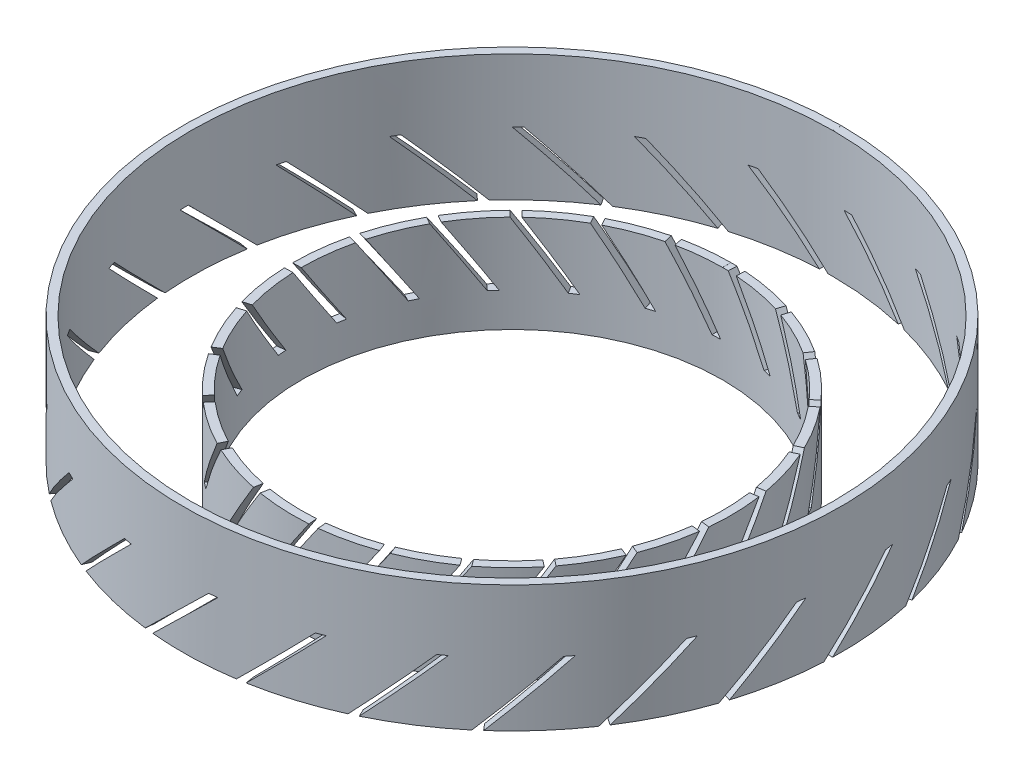
from build123d import *

# Parameters (mm, degrees)
BOSS_EXTRUDE1_DEPTH      = 13
BOSS_EXTRUDE2_DEPTH      = 6.5
BOSS_EXTRUDE2_DEPTH_BACK = 3.5


with BuildPart() as part:
    # Sketch2 → Boss-Extrude1 (new body)
    with BuildSketch(Plane(origin=(0, 0, 0), x_dir=(1, 0, 0), z_dir=(0, 1, 0))):
        with BuildLine():
            ThreePointArc((33, 0), (-23.334523779, -23.334523779), (0, 33))
            Line((0, 33), (0, 33.8636))
            ThreePointArc((0, 33.8636), (-23.945181195, -23.945181195), (33.8636, 0))
            ThreePointArc((33.8636, 0), (23.947270715, 23.943091493), (0.005910313, 33.863599484))
            Line((0.005910313, 33.863599484), (0.005759587, 32.999999497))
            ThreePointArc((0.005759587, 32.999999497), (23.336560012, 23.332487369), (33, 0))
        make_face()
    extrude(amount=BOSS_EXTRUDE1_DEPTH)


with BuildPart() as body_2:
    # Sketch3 → Boss-Extrude2 (new, two sides: drawn at the far end of the back side and taken through both)
    with BuildSketch(Plane(origin=(0, 0, 0), x_dir=(1, 0, 0), z_dir=(0, 1, 0)).offset(-BOSS_EXTRUDE2_DEPTH_BACK)):
        with BuildLine():
            ThreePointArc((21.6364, 0), (-15.29924516, -15.29924516), (0, 21.6364))
            Line((0, 21.6364), (0, 22.5))
            ThreePointArc((0, 22.5), (-15.909902577, -15.909902577), (22.5, 0))
            ThreePointArc((22.5, 0), (15.911290917, 15.908514115), (0.003926991, 22.499999657))
            Line((0.003926991, 22.499999657), (0.003776264, 21.63639967))
            ThreePointArc((0.003776264, 21.63639967), (15.300580213, 15.297909991), (21.6364, 0))
        make_face()
    extrude(amount=BOSS_EXTRUDE2_DEPTH + BOSS_EXTRUDE2_DEPTH_BACK)


with BuildPart() as cut_loft1_tool:
    # Sketch4 → Cut-Loft1 section 0
    with BuildSketch(Plane(origin=(0, 0, 0), x_dir=(1, 0, 0), z_dir=(0, 1, 0))):
        with BuildLine():
            Line((-13.794937288, 42.835571158), (-12.970410671, 43.092399542))
            Line((-12.970410671, 43.092399542), (-4.048628018, 14.449742642))
            Line((-4.048628018, 14.449742642), (-4.873154635, 14.192914258))
            Line((-4.873154635, 14.192914258), (-13.794937288, 42.835571158))
        make_face()
    # Sketch5 → Cut-Loft1 section 1
    with BuildSketch(Plane(origin=(0, 6.5, 0), x_dir=(1, 0, 0), z_dir=(0, 1, 0))):
        with BuildLine():
            Line((-7.559733693, 12.962903908), (-6.801515338, 13.376316397))
            Line((-6.801515338, 13.376316397), (-21.162764368, 39.715536702))
            Line((-21.162764368, 39.715536702), (-21.920982723, 39.302124213))
            Line((-21.920982723, 39.302124213), (-7.559733693, 12.962903908))
        make_face()
    loft()


with BuildPart() as part_1:
    add(part.part)

    # Cut-Loft1: cut by cut_loft1_tool
    add(cut_loft1_tool.part, mode=Mode.SUBTRACT)


with BuildPart() as body_2_1:
    add(body_2.part)

    # Cut-Loft1: cut by cut_loft1_tool
    add(cut_loft1_tool.part, mode=Mode.SUBTRACT)


with BuildPart() as cut_loft2_tool:
    # Sketch4<3> → Cut-Loft2 section 0
    with BuildSketch(Plane(origin=(0, 0, 0), x_dir=(1, 0, 0), z_dir=(0, 1, 0))):
        with BuildLine():
            Line((-24.840282382, 37.525282443), (-24.115622917, 37.995041552))
            Line((-24.115622917, 37.995041552), (-7.796987818, 12.82160022))
            Line((-7.796987818, 12.82160022), (-8.521647282, 12.351841111))
            Line((-8.521647282, 12.351841111), (-24.840282382, 37.525282443))
        make_face()
    # Sketch5<3> → Cut-Loft2 section 1
    with BuildSketch(Plane(origin=(0, 6.5, 0), x_dir=(1, 0, 0), z_dir=(0, 1, 0))):
        with BuildLine():
            Line((-10.77674788, 10.442612526), (-10.158183673, 11.045259423))
            Line((-10.158183673, 11.045259423), (-31.093115225, 32.533131372))
            Line((-31.093115225, 32.533131372), (-31.711679432, 31.930484475))
            Line((-31.711679432, 31.930484475), (-10.77674788, 10.442612526))
        make_face()
    loft()


with BuildPart() as part_2:
    add(part_1.part)

    # Cut-Loft2: cut by cut_loft2_tool
    add(cut_loft2_tool.part, mode=Mode.SUBTRACT)


with BuildPart() as body_2_2:
    add(body_2_1.part)

    # Cut-Loft2: cut by cut_loft2_tool
    add(cut_loft2_tool.part, mode=Mode.SUBTRACT)


with BuildPart() as cut_loft3_tool:
    # Sketch4<4> → Cut-Loft3 section 0
    with BuildSketch(Plane(origin=(0, 0, 0), x_dir=(1, 0, 0), z_dir=(0, 1, 0))):
        with BuildLine():
            Line((-34.043337368, 29.431915196), (-33.472289733, 30.079765147))
            Line((-33.472289733, 30.079765147), (-10.967080699, 10.242538366))
            Line((-10.967080699, 10.242538366), (-11.538128334, 9.594688415))
            Line((-11.538128334, 9.594688415), (-34.043337368, 29.431915196))
        make_face()
    # Sketch5<4> → Cut-Loft3 section 1
    with BuildSketch(Plane(origin=(0, 6.5, 0), x_dir=(1, 0, 0), z_dir=(0, 1, 0))):
        with BuildLine():
            Line((-13.194499977, 7.147840345), (-12.761465995, 7.895026086))
            Line((-12.761465995, 7.895026086), (-38.717431967, 22.937892516))
            Line((-38.717431967, 22.937892516), (-39.150465949, 22.190706776))
            Line((-39.150465949, 22.190706776), (-13.194499977, 7.147840345))
        make_face()
    loft()


with BuildPart() as part_3:
    add(part_2.part)

    # Cut-Loft3: cut by cut_loft3_tool
    add(cut_loft3_tool.part, mode=Mode.SUBTRACT)


with BuildPart() as body_2_3:
    add(body_2_2.part)

    # Cut-Loft3: cut by cut_loft3_tool
    add(cut_loft3_tool.part, mode=Mode.SUBTRACT)


with BuildPart() as cut_loft4_tool:
    # Sketch4<5> → Cut-Loft4 section 0
    with BuildSketch(Plane(origin=(0, 0, 0), x_dir=(1, 0, 0), z_dir=(0, 1, 0))):
        with BuildLine():
            Line((-40.721553759, 19.155717441), (-40.346469945, 19.933610166))
            Line((-40.346469945, 19.933610166), (-13.323795377, 6.903834297))
            Line((-13.323795377, 6.903834297), (-13.698879191, 6.125941572))
            Line((-13.698879191, 6.125941572), (-40.721553759, 19.155717441))
        make_face()
    # Sketch5<5> → Cut-Loft4 section 1
    with BuildSketch(Plane(origin=(0, 6.5, 0), x_dir=(1, 0, 0), z_dir=(0, 1, 0))):
        with BuildLine():
            Line((-14.633676372, 3.322945545), (-14.418288765, 4.159254781))
            Line((-14.418288765, 4.159254781), (-43.470253901, 11.641455107))
            Line((-43.470253901, 11.641455107), (-43.685641508, 10.805145871))
            Line((-43.685641508, 10.805145871), (-14.633676372, 3.322945545))
        make_face()
    loft()


with BuildPart() as part_4:
    add(part_3.part)

    # Cut-Loft4: cut by cut_loft4_tool
    add(cut_loft4_tool.part, mode=Mode.SUBTRACT)


with BuildPart() as body_2_4:
    add(body_2_3.part)

    # Cut-Loft4: cut by cut_loft4_tool
    add(cut_loft4_tool.part, mode=Mode.SUBTRACT)


with BuildPart() as cut_loft5_tool:
    # Sketch4<6> → Cut-Loft5 section 0
    with BuildSketch(Plane(origin=(0, 0, 0), x_dir=(1, 0, 0), z_dir=(0, 1, 0))):
        with BuildLine():
            Line((-44.379638797, 7.458827755), (-44.228337053, 8.309070509))
            Line((-44.228337053, 8.309070509), (-14.692345103, 3.053104421))
            Line((-14.692345103, 3.053104421), (-14.843646847, 2.202861667))
            Line((-14.843646847, 2.202861667), (-44.379638797, 7.458827755))
        make_face()
    # Sketch5<6> → Cut-Loft5 section 1
    with BuildSketch(Plane(origin=(0, 6.5, 0), x_dir=(1, 0, 0), z_dir=(0, 1, 0))):
        with BuildLine():
            Line((-14.987539934, -0.748396925), (-15.005773016, 0.115010577))
            Line((-15.005773016, 0.115010577), (-44.999085966, -0.518375771))
            Line((-44.999085966, -0.518375771), (-44.980852885, -1.381783274))
            Line((-44.980852885, -1.381783274), (-14.987539934, -0.748396925))
        make_face()
    loft()


with BuildPart() as part_5:
    add(part_4.part)

    # Cut-Loft5: cut by cut_loft5_tool
    add(cut_loft5_tool.part, mode=Mode.SUBTRACT)


with BuildPart() as body_2_5:
    add(body_2_4.part)

    # Cut-Loft5: cut by cut_loft5_tool
    add(cut_loft5_tool.part, mode=Mode.SUBTRACT)


with BuildPart() as cut_loft6_tool:
    # Sketch4<7> → Cut-Loft6 section 0
    with BuildSketch(Plane(origin=(0, 0, 0), x_dir=(1, 0, 0), z_dir=(0, 1, 0))):
        with BuildLine():
            Line((-44.746289049, -4.791249064), (-44.829990734, -3.931714895))
            Line((-44.829990734, -3.931714895), (-14.971230806, -1.024060242))
            Line((-14.971230806, -1.024060242), (-14.887529121, -1.883594411))
            Line((-14.887529121, -1.883594411), (-44.746289049, -4.791249064))
        make_face()
    # Sketch5<7> → Cut-Loft6 section 1
    with BuildSketch(Plane(origin=(0, 6.5, 0), x_dir=(1, 0, 0), z_dir=(0, 1, 0))):
        with BuildLine():
            Line((-14.229846224, -4.764234219), (-14.480347729, -3.937763436))
            Line((-14.480347729, -3.937763436), (-43.190541682, -12.63976109))
            Line((-43.190541682, -12.63976109), (-42.940040177, -13.466231874))
            Line((-42.940040177, -13.466231874), (-14.229846224, -4.764234219))
        make_face()
    loft()


with BuildPart() as part_6:
    add(part_5.part)

    # Cut-Loft6: cut by cut_loft6_tool
    add(cut_loft6_tool.part, mode=Mode.SUBTRACT)


with BuildPart() as body_2_6:
    add(body_2_5.part)

    # Cut-Loft6: cut by cut_loft6_tool
    add(cut_loft6_tool.part, mode=Mode.SUBTRACT)


with BuildPart() as cut_loft7_tool:
    # Sketch4<8> → Cut-Loft7 section 0
    with BuildSketch(Plane(origin=(0, 0, 0), x_dir=(1, 0, 0), z_dir=(0, 1, 0))):
        with BuildLine():
            Line((-41.794311742, -16.685980859), (-42.106809086, -15.880902993))
            Line((-42.106809086, -15.880902993), (-14.13976881, -5.025275042))
            Line((-14.13976881, -5.025275042), (-13.827271466, -5.830352908))
            Line((-13.827271466, -5.830352908), (-41.794311742, -16.685980859))
        make_face()
    # Sketch5<8> → Cut-Loft7 section 1
    with BuildSketch(Plane(origin=(0, 6.5, 0), x_dir=(1, 0, 0), z_dir=(0, 1, 0))):
        with BuildLine():
            Line((-12.416789916, -8.426730056), (-12.880981295, -7.698491548))
            Line((-12.880981295, -7.698491548), (-38.178752506, -23.823713152))
            Line((-38.178752506, -23.823713152), (-37.714561126, -24.55195166))
            Line((-37.714561126, -24.55195166), (-12.416789916, -8.426730056))
        make_face()
    loft()


with BuildPart() as part_7:
    add(part_6.part)

    # Cut-Loft7: cut by cut_loft7_tool
    add(cut_loft7_tool.part, mode=Mode.SUBTRACT)


with BuildPart() as body_2_7:
    add(body_2_6.part)

    # Cut-Loft7: cut by cut_loft7_tool
    add(cut_loft7_tool.part, mode=Mode.SUBTRACT)


with BuildPart() as cut_loft8_tool:
    # Sketch4<9> → Cut-Loft8 section 0
    with BuildSketch(Plane(origin=(0, 0, 0), x_dir=(1, 0, 0), z_dir=(0, 1, 0))):
        with BuildLine():
            Line((-35.74264153, -27.343189786), (-36.260758033, -26.652277165))
            Line((-36.260758033, -26.652277165), (-12.259624845, -8.653788182))
            Line((-12.259624845, -8.653788182), (-11.741508342, -9.344700802))
            Line((-11.741508342, -9.344700802), (-35.74264153, -27.343189786))
        make_face()
    # Sketch5<9> → Cut-Loft8 section 1
    with BuildSketch(Plane(origin=(0, 6.5, 0), x_dir=(1, 0, 0), z_dir=(0, 1, 0))):
        with BuildLine():
            Line((-9.682837103, -11.464253874), (-10.326291404, -10.888257761))
            Line((-10.326291404, -10.888257761), (-30.335419911, -33.240769396))
            Line((-30.335419911, -33.240769396), (-29.69196561, -33.816765509))
            Line((-29.69196561, -33.816765509), (-9.682837103, -11.464253874))
        make_face()
    loft()


with BuildPart() as part_8:
    add(part_7.part)

    # Cut-Loft8: cut by cut_loft8_tool
    add(cut_loft8_tool.part, mode=Mode.SUBTRACT)


with BuildPart() as body_2_8:
    add(body_2_7.part)

    # Cut-Loft8: cut by cut_loft8_tool
    add(cut_loft8_tool.part, mode=Mode.SUBTRACT)


with BuildPart() as cut_loft9_tool:
    # Sketch4<10> → Cut-Loft9 section 0
    with BuildSketch(Plane(origin=(0, 0, 0), x_dir=(1, 0, 0), z_dir=(0, 1, 0))):
        with BuildLine():
            Line((-27.040103108, -35.972479414), (-27.725412439, -35.446973867))
            Line((-27.725412439, -35.446973867), (-9.47024059, -11.64048944))
            Line((-9.47024059, -11.64048944), (-8.784931259, -12.165994987))
            Line((-8.784931259, -12.165994987), (-27.040103108, -35.972479414))
        make_face()
    # Sketch5<10> → Cut-Loft9 section 1
    with BuildSketch(Plane(origin=(0, 6.5, 0), x_dir=(1, 0, 0), z_dir=(0, 1, 0))):
        with BuildLine():
            Line((-6.230752558, -13.651526428), (-7.00574772, -13.270491706))
            Line((-7.00574772, -13.270491706), (-20.242247998, -40.19250984))
            Line((-20.242247998, -40.19250984), (-19.467252836, -40.573544561))
            Line((-19.467252836, -40.573544561), (-6.230752558, -13.651526428))
        make_face()
    loft()


with BuildPart() as part_9:
    add(part_8.part)

    # Cut-Loft9: cut by cut_loft9_tool
    add(cut_loft9_tool.part, mode=Mode.SUBTRACT)


with BuildPart() as body_2_9:
    add(body_2_8.part)

    # Cut-Loft9: cut by cut_loft9_tool
    add(cut_loft9_tool.part, mode=Mode.SUBTRACT)


with BuildPart() as cut_loft10_tool:
    # Sketch4<11> → Cut-Loft10 section 0
    with BuildSketch(Plane(origin=(0, 0, 0), x_dir=(1, 0, 0), z_dir=(0, 1, 0))):
        with BuildLine():
            Line((-16.332123938, -41.933854806), (-17.13379984, -41.612730676))
            Line((-17.13379984, -41.612730676), (-5.978491914, -13.763868848))
            Line((-5.978491914, -13.763868848), (-5.176816012, -14.084992979))
            Line((-5.176816012, -14.084992979), (-16.332123938, -41.933854806))
        make_face()
    # Sketch5<11> → Cut-Loft10 section 1
    with BuildSketch(Plane(origin=(0, 6.5, 0), x_dir=(1, 0, 0), z_dir=(0, 1, 0))):
        with BuildLine():
            Line((-2.3165616, -14.826327718), (-3.165619776, -14.66851399))
            Line((-3.165619776, -14.66851399), (-8.647801152, -44.163355698))
            Line((-8.647801152, -44.163355698), (-7.798742976, -44.321169425))
            Line((-7.798742976, -44.321169425), (-2.3165616, -14.826327718))
        make_face()
    loft()


with BuildPart() as part_10:
    add(part_9.part)

    # Cut-Loft10: cut by cut_loft10_tool
    add(cut_loft10_tool.part, mode=Mode.SUBTRACT)


with BuildPart() as body_2_10:
    add(body_2_9.part)

    # Cut-Loft10: cut by cut_loft10_tool
    add(cut_loft10_tool.part, mode=Mode.SUBTRACT)


with BuildPart() as cut_loft11_tool:
    # Sketch4<12> → Cut-Loft11 section 0
    with BuildSketch(Plane(origin=(0, 0, 0), x_dir=(1, 0, 0), z_dir=(0, 1, 0))):
        with BuildLine():
            Line((-4.41286585, -44.785188023), (-5.271451689, -44.692261616))
            Line((-5.271451689, -44.692261616), (-2.043345843, -14.86644507))
            Line((-2.043345843, -14.86644507), (-1.184760004, -14.959371477))
            Line((-1.184760004, -14.959371477), (-4.41286585, -44.785188023))
        make_face()
    # Sketch5<12> → Cut-Loft11 section 1
    with BuildSketch(Plane(origin=(0, 6.5, 0), x_dir=(1, 0, 0), z_dir=(0, 1, 0))):
        with BuildLine():
            Line((1.769438135, -14.901528107), (0.909287704, -14.978639695))
            Line((0.909287704, -14.978639695), (3.588013543, -44.858807497))
            Line((3.588013543, -44.858807497), (4.448163974, -44.781695909))
            Line((4.448163974, -44.781695909), (1.769438135, -14.901528107))
        make_face()
    loft()


with BuildPart() as part_11:
    add(part_10.part)

    # Cut-Loft11: cut by cut_loft11_tool
    add(cut_loft11_tool.part, mode=Mode.SUBTRACT)


with BuildPart() as body_2_11:
    add(body_2_10.part)

    # Cut-Loft11: cut by cut_loft11_tool
    add(cut_loft11_tool.part, mode=Mode.SUBTRACT)


with BuildPart() as cut_loft12_tool:
    # Sketch4<13> → Cut-Loft12 section 0
    with BuildSketch(Plane(origin=(0, 0, 0), x_dir=(1, 0, 0), z_dir=(0, 1, 0))):
        with BuildLine():
            Line((7.833674311, -44.315008722), (6.981855919, -44.457171965))
            Line((6.981855919, -44.457171965), (2.043345843, -14.86644507))
            Line((2.043345843, -14.86644507), (2.895164234, -14.724281826))
            Line((2.895164234, -14.724281826), (7.833674311, -44.315008722))
        make_face()
    # Sketch5<13> → Cut-Loft12 section 1
    with BuildSketch(Plane(origin=(0, 6.5, 0), x_dir=(1, 0, 0), z_dir=(0, 1, 0))):
        with BuildLine():
            Line((5.724206737, -13.871550327), (4.916757476, -14.177868217))
            Line((4.916757476, -14.177868217), (15.557721689, -42.22728676))
            Line((15.557721689, -42.22728676), (16.365170951, -41.92096887))
            Line((16.365170951, -41.92096887), (5.724206737, -13.871550327))
        make_face()
    loft()


with BuildPart() as part_12:
    add(part_11.part)

    # Cut-Loft12: cut by cut_loft12_tool
    add(cut_loft12_tool.part, mode=Mode.SUBTRACT)


with BuildPart() as body_2_12:
    add(body_2_11.part)

    # Cut-Loft12: cut by cut_loft12_tool
    add(cut_loft12_tool.part, mode=Mode.SUBTRACT)


with BuildPart() as cut_loft13_tool:
    # Sketch4<14> → Cut-Loft13 section 0
    with BuildSketch(Plane(origin=(0, 0, 0), x_dir=(1, 0, 0), z_dir=(0, 1, 0))):
        with BuildLine():
            Line((19.499226684, -40.558187952), (18.717351213, -40.924897248))
            Line((18.717351213, -40.924897248), (5.978491914, -13.763868848))
            Line((5.978491914, -13.763868848), (6.760367385, -13.397159552))
            Line((6.760367385, -13.397159552), (19.499226684, -40.558187952))
        make_face()
    # Sketch5<14> → Cut-Loft13 section 1
    with BuildSketch(Plane(origin=(0, 6.5, 0), x_dir=(1, 0, 0), z_dir=(0, 1, 0))):
        with BuildLine():
            Line((9.254437113, -11.812783117), (8.559573838, -12.325589112))
            Line((8.559573838, -12.325589112), (26.373584788, -36.463961341))
            Line((26.373584788, -36.463961341), (27.068448064, -35.951155345))
            Line((27.068448064, -35.951155345), (9.254437113, -11.812783117))
        make_face()
    loft()


with BuildPart() as part_13:
    add(part_12.part)

    # Cut-Loft13: cut by cut_loft13_tool
    add(cut_loft13_tool.part, mode=Mode.SUBTRACT)


with BuildPart() as body_2_13:
    add(body_2_12.part)

    # Cut-Loft13: cut by cut_loft13_tool
    add(cut_loft13_tool.part, mode=Mode.SUBTRACT)


with BuildPart() as cut_loft14_tool:
    # Sketch4<15> → Cut-Loft14 section 0
    with BuildSketch(Plane(origin=(0, 0, 0), x_dir=(1, 0, 0), z_dir=(0, 1, 0))):
        with BuildLine():
            Line((29.718610618, -33.793351923), (29.064666194, -34.357410121))
            Line((29.064666194, -34.357410121), (9.47024059, -11.64048944))
            Line((9.47024059, -11.64048944), (10.124185014, -11.076431242))
            Line((10.124185014, -11.076431242), (29.718610618, -33.793351923))
        make_face()
    # Sketch5<15> → Cut-Loft14 section 1
    with BuildSketch(Plane(origin=(0, 6.5, 0), x_dir=(1, 0, 0), z_dir=(0, 1, 0))):
        with BuildLine():
            Line((12.098308224, -8.877915823), (11.567565766, -9.559177449))
            Line((11.567565766, -9.559177449), (35.233439755, -27.99627072))
            Line((35.233439755, -27.99627072), (35.764182214, -27.315009094))
            Line((35.764182214, -27.315009094), (12.098308224, -8.877915823))
        make_face()
    loft()


with BuildPart() as part_14:
    add(part_13.part)

    # Cut-Loft14: cut by cut_loft14_tool
    add(cut_loft14_tool.part, mode=Mode.SUBTRACT)


with BuildPart() as body_2_14:
    add(body_2_13.part)

    # Cut-Loft14: cut by cut_loft14_tool
    add(cut_loft14_tool.part, mode=Mode.SUBTRACT)


with BuildPart() as cut_loft15_tool:
    # Sketch4<16> → Cut-Loft15 section 0
    with BuildSketch(Plane(origin=(0, 0, 0), x_dir=(1, 0, 0), z_dir=(0, 1, 0))):
        with BuildLine():
            Line((37.733901155, -24.522217576), (37.256387846, -25.24179106))
            Line((37.256387846, -25.24179106), (12.259624845, -8.653788182))
            Line((12.259624845, -8.653788182), (12.737138155, -7.934214697))
            Line((12.737138155, -7.934214697), (37.733901155, -24.522217576))
        make_face()
    # Sketch5<16> → Cut-Loft15 section 1
    with BuildSketch(Plane(origin=(0, 6.5, 0), x_dir=(1, 0, 0), z_dir=(0, 1, 0))):
        with BuildLine():
            Line((14.04490316, -5.284614126), (13.717644259, -6.083805324))
            Line((13.717644259, -6.083805324), (41.480191678, -17.452224775))
            Line((41.480191678, -17.452224775), (41.807450579, -16.653033577))
            Line((41.807450579, -16.653033577), (14.04490316, -5.284614126))
        make_face()
    loft()


with BuildPart() as part_15:
    add(part_14.part)

    # Cut-Loft15: cut by cut_loft15_tool
    add(cut_loft15_tool.part, mode=Mode.SUBTRACT)


with BuildPart() as body_2_15:
    add(body_2_14.part)

    # Cut-Loft15: cut by cut_loft15_tool
    add(cut_loft15_tool.part, mode=Mode.SUBTRACT)


with BuildPart() as cut_loft16_tool:
    # Sketch4<17> → Cut-Loft16 section 0
    with BuildSketch(Plane(origin=(0, 0, 0), x_dir=(1, 0, 0), z_dir=(0, 1, 0))):
        with BuildLine():
            Line((42.950640865, -13.432382533), (42.684973647, -14.25410383))
            Line((42.684973647, -14.25410383), (14.13976881, -5.025275042))
            Line((14.13976881, -5.025275042), (14.405436028, -4.203553746))
            Line((14.405436028, -4.203553746), (42.950640865, -13.432382533))
        make_face()
    # Sketch5<17> → Cut-Loft16 section 1
    with BuildSketch(Plane(origin=(0, 6.5, 0), x_dir=(1, 0, 0), z_dir=(0, 1, 0))):
        with BuildLine():
            Line((14.94985188, -1.299376775), (14.850347831, -2.157225191))
            Line((14.850347831, -2.157225191), (44.650547543, -5.613827157))
            Line((44.650547543, -5.613827157), (44.750051592, -4.755978741))
            Line((44.750051592, -4.755978741), (14.94985188, -1.299376775))
        make_face()
    loft()


with BuildPart() as part_16:
    add(part_15.part)

    # Cut-Loft16: cut by cut_loft16_tool
    add(cut_loft16_tool.part, mode=Mode.SUBTRACT)


with BuildPart() as body_2_16:
    add(body_2_15.part)

    # Cut-Loft16: cut by cut_loft16_tool
    add(cut_loft16_tool.part, mode=Mode.SUBTRACT)


with BuildPart() as cut_loft17_tool:
    # Sketch4<18> → Cut-Loft17 section 0
    with BuildSketch(Plane(origin=(0, 0, 0), x_dir=(1, 0, 0), z_dir=(0, 1, 0))):
        with BuildLine():
            Line((44.981928028, -1.346329127), (44.947810224, -2.209254927))
            Line((44.947810224, -2.209254927), (14.971230806, -1.024060242))
            Line((14.971230806, -1.024060242), (15.005348611, -0.161134443))
            Line((15.005348611, -0.161134443), (44.981928028, -1.346329127))
        make_face()
    # Sketch5<18> → Cut-Loft17 section 1
    with BuildSketch(Plane(origin=(0, 6.5, 0), x_dir=(1, 0, 0), z_dir=(0, 1, 0))):
        with BuildLine():
            Line((14.746038477, 2.782229407), (14.881669041, 1.929346466))
            Line((14.881669041, 1.929346466), (44.509376559, 6.64092234))
            Line((44.509376559, 6.64092234), (44.373745995, 7.49380528))
            Line((44.373745995, 7.49380528), (14.746038477, 2.782229407))
        make_face()
    loft()


with BuildPart() as part_17:
    add(part_16.part)

    # Cut-Loft17: cut by cut_loft17_tool
    add(cut_loft17_tool.part, mode=Mode.SUBTRACT)


with BuildPart() as body_2_17:
    add(body_2_16.part)

    # Cut-Loft17: cut by cut_loft17_tool
    add(cut_loft17_tool.part, mode=Mode.SUBTRACT)


with BuildPart() as cut_loft18_tool:
    # Sketch4<19> → Cut-Loft18 section 0
    with BuildSketch(Plane(origin=(0, 0, 0), x_dir=(1, 0, 0), z_dir=(0, 1, 0))):
        with BuildLine():
            Line((43.677111368, 10.839575351), (43.877073339, 9.999444308))
            Line((43.877073339, 9.999444308), (14.692345103, 3.053104421))
            Line((14.692345103, 3.053104421), (14.492383132, 3.893235465))
            Line((14.492383132, 3.893235465), (43.677111368, 10.839575351))
        make_face()
    # Sketch5<19> → Cut-Loft18 section 1
    with BuildSketch(Plane(origin=(0, 6.5, 0), x_dir=(1, 0, 0), z_dir=(0, 1, 0))):
        with BuildLine():
            Line((13.448578859, 6.657490362), (13.809284937, 5.872827323))
            Line((13.809284937, 5.872827323), (41.067148733, 18.403145007))
            Line((41.067148733, 18.403145007), (40.706442655, 19.187808046))
            Line((40.706442655, 19.187808046), (13.448578859, 6.657490362))
        make_face()
    loft()


with BuildPart() as part_18:
    add(part_17.part)

    # Cut-Loft18: cut by cut_loft18_tool
    add(cut_loft18_tool.part, mode=Mode.SUBTRACT)


with BuildPart() as body_2_18:
    add(body_2_17.part)

    # Cut-Loft18: cut by cut_loft18_tool
    add(cut_loft18_tool.part, mode=Mode.SUBTRACT)


with BuildPart() as cut_loft19_tool:
    # Sketch4<20> → Cut-Loft19 section 0
    with BuildSketch(Plane(origin=(0, 0, 0), x_dir=(1, 0, 0), z_dir=(0, 1, 0))):
        with BuildLine():
            Line((39.132963167, 22.221558114), (39.552174648, 21.466530503))
            Line((39.552174648, 21.466530503), (13.323795377, 6.903834297))
            Line((13.323795377, 6.903834297), (12.904583895, 7.658861908))
            Line((12.904583895, 7.658861908), (39.132963167, 22.221558114))
        make_face()
    # Sketch5<20> → Cut-Loft19 section 1
    with BuildSketch(Plane(origin=(0, 6.5, 0), x_dir=(1, 0, 0), z_dir=(0, 1, 0))):
        with BuildLine():
            Line((11.15369967, 10.038995712), (11.712729343, 9.380747443))
            Line((11.712729343, 9.380747443), (34.579158355, 28.800490598))
            Line((34.579158355, 28.800490598), (34.020128682, 29.458738868))
            Line((34.020128682, 29.458738868), (11.15369967, 10.038995712))
        make_face()
    loft()


with BuildPart() as part_19:
    add(part_18.part)

    # Cut-Loft19: cut by cut_loft19_tool
    add(cut_loft19_tool.part, mode=Mode.SUBTRACT)


with BuildPart() as body_2_19:
    add(body_2_18.part)

    # Cut-Loft19: cut by cut_loft19_tool
    add(cut_loft19_tool.part, mode=Mode.SUBTRACT)


with BuildPart() as cut_loft20_tool:
    # Sketch4<21> → Cut-Loft20 section 0
    with BuildSketch(Plane(origin=(0, 0, 0), x_dir=(1, 0, 0), z_dir=(0, 1, 0))):
        with BuildLine():
            Line((31.686502109, 31.955469568), (32.293872104, 31.341542333))
            Line((32.293872104, 31.341542333), (10.967080699, 10.242538366))
            Line((10.967080699, 10.242538366), (10.359710705, 10.856465601))
            Line((10.359710705, 10.856465601), (31.686502109, 31.955469568))
        make_face()
    # Sketch5<21> → Cut-Loft20 section 1
    with BuildSketch(Plane(origin=(0, 6.5, 0), x_dir=(1, 0, 0), z_dir=(0, 1, 0))):
        with BuildLine():
            Line((8.031601601, 12.675954677), (8.747494195, 12.192940439))
            Line((8.747494195, 12.192940439), (25.526589991, 37.061835554))
            Line((25.526589991, 37.061835554), (24.810697397, 37.544849792))
            Line((24.810697397, 37.544849792), (8.031601601, 12.675954677))
        make_face()
    loft()


with BuildPart() as part_20:
    add(part_19.part)

    # Cut-Loft20: cut by cut_loft20_tool
    add(cut_loft20_tool.part, mode=Mode.SUBTRACT)


with BuildPart() as body_2_20:
    add(body_2_19.part)

    # Cut-Loft20: cut by cut_loft20_tool
    add(cut_loft20_tool.part, mode=Mode.SUBTRACT)


with BuildPart() as cut_loft21_tool:
    # Sketch4<22> → Cut-Loft21 section 0
    with BuildSketch(Plane(origin=(0, 0, 0), x_dir=(1, 0, 0), z_dir=(0, 1, 0))):
        with BuildLine():
            Line((21.889998147, 39.319390031), (22.6404808, 38.892095346))
            Line((22.6404808, 38.892095346), (7.796987818, 12.82160022))
            Line((7.796987818, 12.82160022), (7.046505165, 13.248894905))
            Line((7.046505165, 13.248894905), (21.889998147, 39.319390031))
        make_face()
    # Sketch5<22> → Cut-Loft21 section 1
    with BuildSketch(Plane(origin=(0, 6.5, 0), x_dir=(1, 0, 0), z_dir=(0, 1, 0))):
        with BuildLine():
            Line((4.313836384, 14.372796071), (5.13349742, 14.100838822))
            Line((5.13349742, 14.100838822), (14.580831224, 42.574473714))
            Line((14.580831224, 42.574473714), (13.761170188, 42.846430963))
            Line((13.761170188, 42.846430963), (4.313836384, 14.372796071))
        make_face()
    loft()


with BuildPart() as part_21:
    add(part_20.part)

    # Cut-Loft21: cut by cut_loft21_tool
    add(cut_loft21_tool.part, mode=Mode.SUBTRACT)


with BuildPart() as body_2_21:
    add(body_2_20.part)

    # Cut-Loft21: cut by cut_loft21_tool
    add(cut_loft21_tool.part, mode=Mode.SUBTRACT)


with BuildPart() as cut_loft22_tool:
    # Sketch4<23> → Cut-Loft22 section 0
    with BuildSketch(Plane(origin=(0, 0, 0), x_dir=(1, 0, 0), z_dir=(0, 1, 0))):
        with BuildLine():
            Line((10.470013161, 43.767171209), (11.307948608, 43.558199567))
            Line((11.307948608, 43.558199567), (4.048628018, 14.449742642))
            Line((4.048628018, 14.449742642), (3.210692572, 14.658714284))
            Line((3.210692572, 14.658714284), (10.470013161, 43.767171209))
        make_face()
    # Sketch5<23> → Cut-Loft22 section 1
    with BuildSketch(Plane(origin=(0, 6.5, 0), x_dir=(1, 0, 0), z_dir=(0, 1, 0))):
        with BuildLine():
            Line((0.276133656, 15.003672932), (1.138772626, 14.962942496))
            Line((1.138772626, 14.962942496), (2.553678908, 44.929557924))
            Line((2.553678908, 44.929557924), (1.691039938, 44.97028836))
            Line((1.691039938, 44.97028836), (0.276133656, 15.003672932))
        make_face()
    loft()


with BuildPart() as part_22:
    add(part_21.part)

    # Cut-Loft22: cut by cut_loft22_tool
    add(cut_loft22_tool.part, mode=Mode.SUBTRACT)


with BuildPart() as body_2_22:
    add(body_2_21.part)

    # Cut-Loft22: cut by cut_loft22_tool
    add(cut_loft22_tool.part, mode=Mode.SUBTRACT)


with BuildPart() as cut_loft23_tool:
    # Sketch4<24> → Cut-Loft23 section 0
    with BuildSketch(Plane(origin=(0, 0, 0), x_dir=(1, 0, 0), z_dir=(0, 1, 0))):
        with BuildLine():
            Line((-0.863242402, 44.993791392), (0, 15.006213754))
            Line((0, 15.006213754), (-0.863242402, 14.981363883))
            Line((-0.863242402, 14.981363883), (-1.726484803, 44.96894152))
            Line((-1.726484803, 44.96894152), (-0.863242402, 44.993791392))
        make_face()
    # Sketch5<24> → Cut-Loft23 section 1
    with BuildSketch(Plane(origin=(0, 6.5, 0), x_dir=(1, 0, 0), z_dir=(0, 1, 0))):
        with BuildLine():
            Line((-3.782048641, 14.521796009), (-2.940409725, 14.715313177))
            Line((-2.940409725, 14.715313177), (-9.662868091, 43.952422362))
            Line((-9.662868091, 43.952422362), (-10.504507007, 43.758905194))
            Line((-10.504507007, 43.758905194), (-3.782048641, 14.521796009))
        make_face()
    loft()


with BuildPart() as part_23:
    add(part_22.part)

    # Cut-Loft23: cut by cut_loft23_tool
    add(cut_loft23_tool.part, mode=Mode.SUBTRACT)


with BuildPart() as body_2_23:
    add(body_2_22.part)

    # Cut-Loft23: cut by cut_loft23_tool
    add(cut_loft23_tool.part, mode=Mode.SUBTRACT)


solid = Compound([part_23.part, body_2_23.part])
